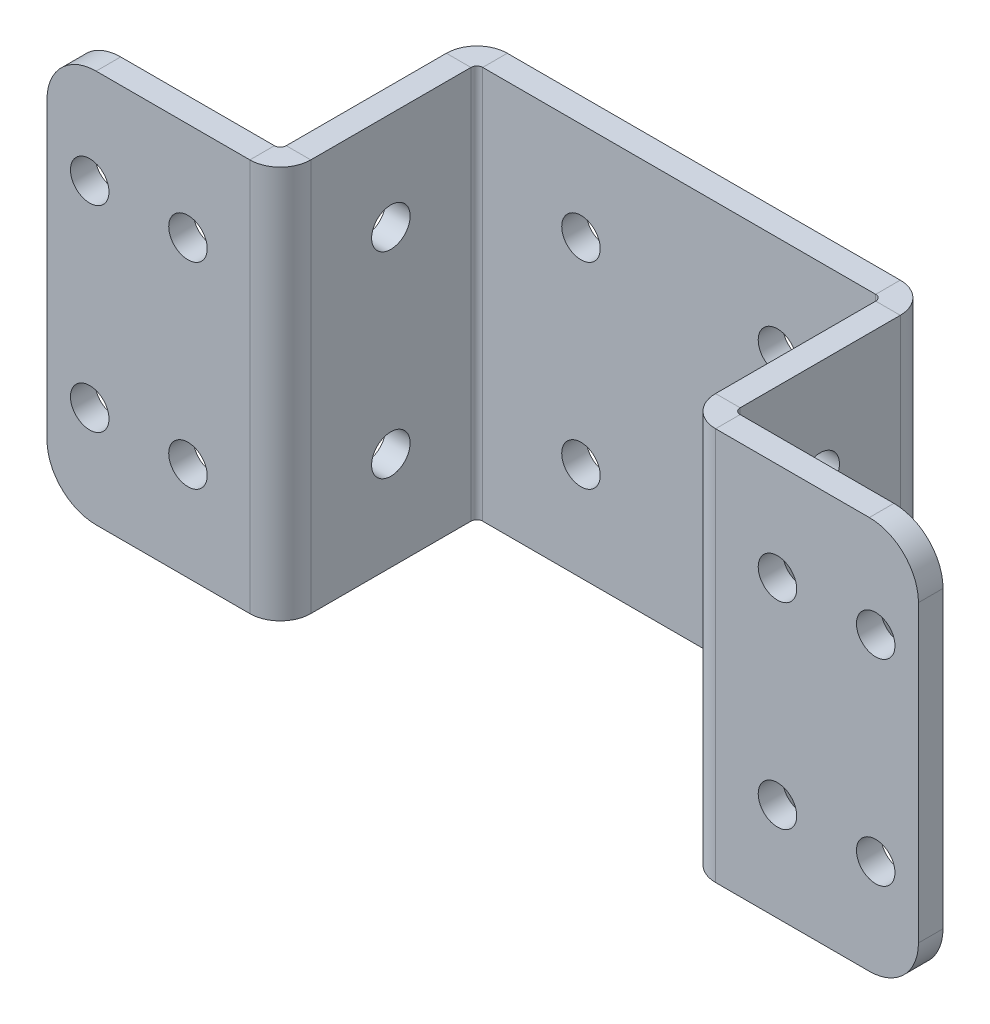
from build123d import *

# Parameters (mm, degrees)
SKETCH1_W                    = 50.8
SKETCH1_H                    = 50.8
BASE_FLANGE1_DEPTH           = 3.175
EDGE_FLANGE1_DEPTH           = 50.8
EDGE_FLANGE2_STRIP_W         = 14.224
EDGE_FLANGE2_STRIP_H         = 3.175
EDGE_FLANGE2_STRIP_CUT_DEPTH = 50.8
EDGE_FLANGE2_DEPTH           = 50.8
CUT_EXTRUDE1_REACH           = 80.879
SKETCH16_R                   = 2.4892
CUT_EXTRUDE2_REACH           = 81.989
SKETCH17_R                   = 2.4892
CUT_EXTRUDE3_REACH           = 83.053
SKETCH18_R                   = 2.4892
FILLET1_R                    = 6.35
FILLET1_OF_MIRROR1_R         = 6.35


# Sheet-metal steps are written as plain solids
with BuildPart() as part:
    # Sketch1 → Base-Flange1 (new body)
    with BuildSketch(Plane.XY):
        with Locations((0, 25.4)):
            Rectangle(SKETCH1_W, SKETCH1_H)
    extrude(amount=-BASE_FLANGE1_DEPTH)

    # Edge-Flange1 section (across the edge) → Edge-Flange1 (add)
    with BuildSketch(Plane(origin=(26.162, 0, 0), x_dir=(-1, 0, 0), z_dir=(0, 1, 0))):
        with BuildLine():
            Line((-3.175, 0.762), (-3.175, 22.225))
            Line((-3.175, 22.225), (0, 22.225))
            Line((0, 22.225), (0, 0.762))
            ThreePointArc((0, 0.762), (0.223184633, 0.223184633), (0.762, 0))
            Line((0.762, 0), (0.762, -3.175))
            ThreePointArc((0.762, -3.175), (-2.021879398, -2.021879398), (-3.175, 0.762))
        make_face()
    edge_flange1 = extrude(amount=EDGE_FLANGE1_DEPTH)

    # Edge-Flange2 strip (across the edge) → Edge-Flange2 strip cut (cut)
    with BuildSketch(Plane(origin=(29.337, 50.8, 22.225), x_dir=(0, 0, -1), z_dir=(0, -1, 0))):
        with Locations((-6.35, -1.5875)):
            Rectangle(EDGE_FLANGE2_STRIP_W, EDGE_FLANGE2_STRIP_H)
    edge_flange2_strip_cut = extrude(amount=EDGE_FLANGE2_STRIP_CUT_DEPTH, mode=Mode.SUBTRACT)

    # Edge-Flange2 section (across the edge) → Edge-Flange2 (add)
    with BuildSketch(Plane(origin=(29.337, 50.8, 22.225), x_dir=(0, 0, -1), z_dir=(0, -1, 0))):
        with BuildLine():
            Line((-3.175, 0.762), (-3.175, 26.9875))
            Line((-3.175, 26.9875), (0, 26.9875))
            Line((0, 26.9875), (0, 0.762))
            ThreePointArc((0, 0.762), (0.223184633, 0.223184633), (0.762, 0))
            Line((0.762, 0), (0.762, -3.175))
            ThreePointArc((0.762, -3.175), (-2.021879398, -2.021879398), (-3.175, 0.762))
        make_face()
    edge_flange2 = extrude(amount=EDGE_FLANGE2_DEPTH)

    # Sketch16 → Cut-Extrude1 (cut, up to next)
    with BuildSketch(Plane(origin=(29.337, 0, 0), x_dir=(0, 0, -1), z_dir=(1, 0, 0)), mode=Mode.PRIVATE) as cut_extrude1_sk1:
        with Locations((-11.1125, 38.1)):
            Circle(SKETCH16_R)
    cut_extrude1_tool1 = extrude(cut_extrude1_sk1.sketch, amount=-CUT_EXTRUDE1_REACH, mode=Mode.PRIVATE) & part.part
    # Sketch16 → Cut-Extrude1 (cut, up to next)
    with BuildSketch(Plane(origin=(29.337, 0, 0), x_dir=(0, 0, -1), z_dir=(1, 0, 0)), mode=Mode.PRIVATE) as cut_extrude1_sk2:
        with Locations((-11.1125, 12.7)):
            Circle(SKETCH16_R)
    cut_extrude1_tool2 = extrude(cut_extrude1_sk2.sketch, amount=-CUT_EXTRUDE1_REACH, mode=Mode.PRIVATE) & part.part
    cut_extrude1_1 = cut_extrude1_tool1.solids().sort_by_distance((29.337, 38.1, 11.1125))[0]
    add(cut_extrude1_1, mode=Mode.SUBTRACT)
    cut_extrude1_2 = cut_extrude1_tool2.solids().sort_by_distance((29.337, 12.7, 11.1125))[0]
    add(cut_extrude1_2, mode=Mode.SUBTRACT)
    cut_extrude1 = cut_extrude1_1 + cut_extrude1_2  # Cut-Extrude1 as one shape, for the pattern or mirror that repeats it

    # Sketch17 → Cut-Extrude2 (cut, up to next)
    with BuildSketch(Plane(origin=(0, 0, 22.225), x_dir=(-1, 0, 0), z_dir=(0, 0, -1)), mode=Mode.PRIVATE) as cut_extrude2_sk1:
        with Locations((-50.8, 38.1)):
            Circle(SKETCH17_R)
    cut_extrude2_tool1 = extrude(cut_extrude2_sk1.sketch, amount=-CUT_EXTRUDE2_REACH, mode=Mode.PRIVATE) & part.part
    # Sketch17 → Cut-Extrude2 (cut, up to next)
    with BuildSketch(Plane(origin=(0, 0, 22.225), x_dir=(-1, 0, 0), z_dir=(0, 0, -1)), mode=Mode.PRIVATE) as cut_extrude2_sk2:
        with Locations((-38.1, 38.1)):
            Circle(SKETCH17_R)
    cut_extrude2_tool2 = extrude(cut_extrude2_sk2.sketch, amount=-CUT_EXTRUDE2_REACH, mode=Mode.PRIVATE) & part.part
    # Sketch17 → Cut-Extrude2 (cut, up to next)
    with BuildSketch(Plane(origin=(0, 0, 22.225), x_dir=(-1, 0, 0), z_dir=(0, 0, -1)), mode=Mode.PRIVATE) as cut_extrude2_sk3:
        with Locations((-38.1, 12.7)):
            Circle(SKETCH17_R)
    cut_extrude2_tool3 = extrude(cut_extrude2_sk3.sketch, amount=-CUT_EXTRUDE2_REACH, mode=Mode.PRIVATE) & part.part
    # Sketch17 → Cut-Extrude2 (cut, up to next)
    with BuildSketch(Plane(origin=(0, 0, 22.225), x_dir=(-1, 0, 0), z_dir=(0, 0, -1)), mode=Mode.PRIVATE) as cut_extrude2_sk4:
        with Locations((-50.8, 12.7)):
            Circle(SKETCH17_R)
    cut_extrude2_tool4 = extrude(cut_extrude2_sk4.sketch, amount=-CUT_EXTRUDE2_REACH, mode=Mode.PRIVATE) & part.part
    cut_extrude2_1 = cut_extrude2_tool1.solids().sort_by_distance((50.8, 38.1, 22.225))[0]
    add(cut_extrude2_1, mode=Mode.SUBTRACT)
    cut_extrude2_2 = cut_extrude2_tool2.solids().sort_by_distance((38.1, 38.1, 22.225))[0]
    add(cut_extrude2_2, mode=Mode.SUBTRACT)
    cut_extrude2_3 = cut_extrude2_tool3.solids().sort_by_distance((38.1, 12.7, 22.225))[0]
    add(cut_extrude2_3, mode=Mode.SUBTRACT)
    cut_extrude2_4 = cut_extrude2_tool4.solids().sort_by_distance((50.8, 12.7, 22.225))[0]
    add(cut_extrude2_4, mode=Mode.SUBTRACT)
    cut_extrude2 = cut_extrude2_1 + cut_extrude2_2 + cut_extrude2_3 + cut_extrude2_4  # Cut-Extrude2 as one shape, for the pattern or mirror that repeats it

    # Sketch18 → Cut-Extrude3 (cut, up to next)
    with BuildSketch(Plane(origin=(0, 0, -3.175), x_dir=(-1, 0, 0), z_dir=(0, 0, -1)), mode=Mode.PRIVATE) as cut_extrude3_sk1:
        with Locations((-12.7, 38.1)):
            Circle(SKETCH18_R)
    cut_extrude3_tool1 = extrude(cut_extrude3_sk1.sketch, amount=-CUT_EXTRUDE3_REACH, mode=Mode.PRIVATE) & part.part
    # Sketch18 → Cut-Extrude3 (cut, up to next)
    with BuildSketch(Plane(origin=(0, 0, -3.175), x_dir=(-1, 0, 0), z_dir=(0, 0, -1)), mode=Mode.PRIVATE) as cut_extrude3_sk2:
        with Locations((12.7, 38.1)):
            Circle(SKETCH18_R)
    cut_extrude3_tool2 = extrude(cut_extrude3_sk2.sketch, amount=-CUT_EXTRUDE3_REACH, mode=Mode.PRIVATE) & part.part
    # Sketch18 → Cut-Extrude3 (cut, up to next)
    with BuildSketch(Plane(origin=(0, 0, -3.175), x_dir=(-1, 0, 0), z_dir=(0, 0, -1)), mode=Mode.PRIVATE) as cut_extrude3_sk3:
        with Locations((12.7, 12.7)):
            Circle(SKETCH18_R)
    cut_extrude3_tool3 = extrude(cut_extrude3_sk3.sketch, amount=-CUT_EXTRUDE3_REACH, mode=Mode.PRIVATE) & part.part
    # Sketch18 → Cut-Extrude3 (cut, up to next)
    with BuildSketch(Plane(origin=(0, 0, -3.175), x_dir=(-1, 0, 0), z_dir=(0, 0, -1)), mode=Mode.PRIVATE) as cut_extrude3_sk4:
        with Locations((-12.7, 12.7)):
            Circle(SKETCH18_R)
    cut_extrude3_tool4 = extrude(cut_extrude3_sk4.sketch, amount=-CUT_EXTRUDE3_REACH, mode=Mode.PRIVATE) & part.part
    add(cut_extrude3_tool1.solids().sort_by_distance((12.7, 38.1, -3.175))[0], mode=Mode.SUBTRACT)
    add(cut_extrude3_tool2.solids().sort_by_distance((-12.7, 38.1, -3.175))[0], mode=Mode.SUBTRACT)
    add(cut_extrude3_tool3.solids().sort_by_distance((-12.7, 12.7, -3.175))[0], mode=Mode.SUBTRACT)
    add(cut_extrude3_tool4.solids().sort_by_distance((12.7, 12.7, -3.175))[0], mode=Mode.SUBTRACT)

    # Fillet1
    fillet1_edges = [part.edges().sort_by_distance(p)[0] for p in [
        (56.3245, 50.8, 23.8125),
        (56.3245, 0, 23.8125),
    ]]
    fillet(fillet1_edges, radius=FILLET1_R)

    # Mirror1: Edge-Flange1, Edge-Flange2 strip cut, Edge-Flange2, Cut-Extrude1, Cut-Extrude2 across plane
    add(edge_flange1.mirror(Plane(origin=(0, 0, 0), x_dir=(0, 0, 1), z_dir=(1, 0, 0))))
    add(edge_flange2_strip_cut.mirror(Plane(origin=(0, 0, 0), x_dir=(0, 0, 1), z_dir=(1, 0, 0))), mode=Mode.SUBTRACT)
    add(edge_flange2.mirror(Plane(origin=(0, 0, 0), x_dir=(0, 0, 1), z_dir=(1, 0, 0))))
    add(cut_extrude1.mirror(Plane(origin=(0, 0, 0), x_dir=(0, 0, 1), z_dir=(1, 0, 0))), mode=Mode.SUBTRACT)
    add(cut_extrude2.mirror(Plane(origin=(0, 0, 0), x_dir=(0, 0, 1), z_dir=(1, 0, 0))), mode=Mode.SUBTRACT)

    # Fillet1 of Mirror1
    fillet1_of_mirror1_edges = [part.edges().sort_by_distance(p)[0] for p in [
        (-56.3245, 50.8, 23.8125),
        (-56.3245, 0, 23.8125),
    ]]
    fillet(fillet1_of_mirror1_edges, radius=FILLET1_OF_MIRROR1_R)


solid = part.part
